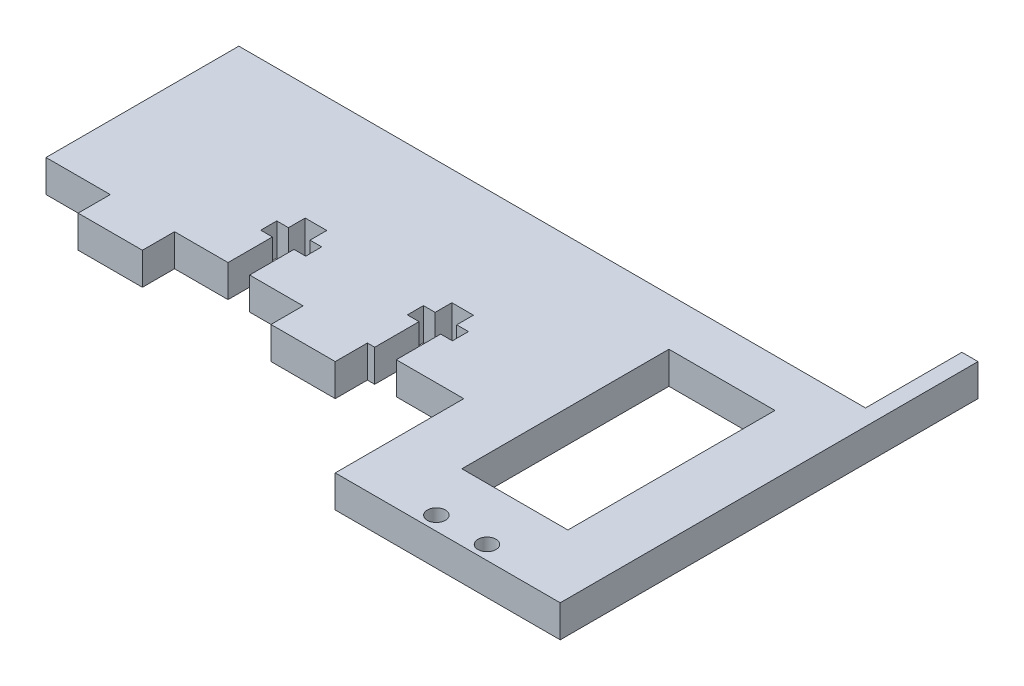
from build123d import *

# Parameters (mm, degrees)
BOSS_EXTRUDE1_DEPTH = 6.35
SKETCH4_W           = 20.950480973
SKETCH4_H           = 40.91890815
CUT_EXTRUDE2_DEPTH  = 79.730852648
SKETCH5_R           = 1.778
SKETCH5_W           = 123.825
SKETCH5_H           = 19.05
CUT_EXTRUDE3_DEPTH  = 79.730852648
CUT_EXTRUDE4_DEPTH  = 79.730852648


with BuildPart() as part:
    # Sketch1 → Boss-Extrude1 (new body)
    with BuildSketch(Plane(origin=(0, 0, 0), x_dir=(1, 0, 0), z_dir=(0, 1, 0))):
        Polygon((64.810443043, 44.247385587), (64.810443043, -38.302614413), (20.360443043, -38.302614413), (20.360443043, -12.902614413), (1.310443043, -12.902614413), (1.310443043, -19.252614413), (-11.389556957, -19.252614413), (-11.389556957, -12.902614413), (-36.789556957, -12.902614413), (-36.789556957, -19.252614413), (-49.489556957, -19.252614413), (-49.489556957, -12.902614413), (-62.189556957, -12.902614413), (-62.189556957, 44.247385587), align=None)
    extrude(amount=BOSS_EXTRUDE1_DEPTH)

    # Sketch4 → Cut-Extrude2 (cut, through all)
    with BuildSketch(Plane.XZ):
        with Locations((42.642368246, 4.632403749)):
            Rectangle(SKETCH4_W, SKETCH4_H)
    extrude(amount=-CUT_EXTRUDE2_DEPTH, mode=Mode.SUBTRACT)

    # Sketch5 → Cut-Extrude3 (cut, through all)
    with BuildSketch(Plane(origin=(0, 6.35, 0), x_dir=(1, 0, 0), z_dir=(0, 1, 0))):
        with Locations((47.585443043, -35.55098931)):
            Circle(SKETCH5_R)
        with Locations((37.585443043, -35.55098931)):
            Circle(SKETCH5_R)
        with Locations((47.585443043, 13.44901069)):
            Circle(SKETCH5_R)
        with Locations((37.585443043, 13.44901069)):
            Circle(SKETCH5_R)
        with Locations((-0.277056957, 34.722385587)):
            Rectangle(SKETCH5_W, SKETCH5_H)
    extrude(amount=-CUT_EXTRUDE3_DEPTH, mode=Mode.SUBTRACT)

    # Sketch6 → Cut-Extrude4 (cut, through all)
    with BuildSketch(Plane(origin=(0, 6.35, 0), x_dir=(1, 0, 0), z_dir=(0, 1, 0))):
        Polygon((2.758977506, -12.902614413), (7.026177506, -12.902614413), (7.026177506, -4.139614413), (9.337577506, -4.139614413), (9.337577506, -0.964614413), (7.026177506, -0.964614413), (7.026177506, 2.337385587), (2.758977506, 2.337385587), (2.758977506, -0.964614413), (0.447577506, -0.964614413), (0.447577506, -4.139614413), (2.758977506, -4.139614413), align=None)
        Polygon((-26.223156957, -12.902614413), (-21.955956957, -12.902614413), (-21.955956957, -4.139614413), (-19.644556957, -4.139614413), (-19.644556957, -0.964614413), (-21.955956957, -0.964614413), (-21.955956957, 2.337385587), (-26.223156957, 2.337385587), (-26.223156957, -0.964614413), (-28.534556957, -0.964614413), (-28.534556957, -4.139614413), (-26.223156957, -4.139614413), align=None)
    extrude(amount=-CUT_EXTRUDE4_DEPTH, mode=Mode.SUBTRACT)


solid = part.part
